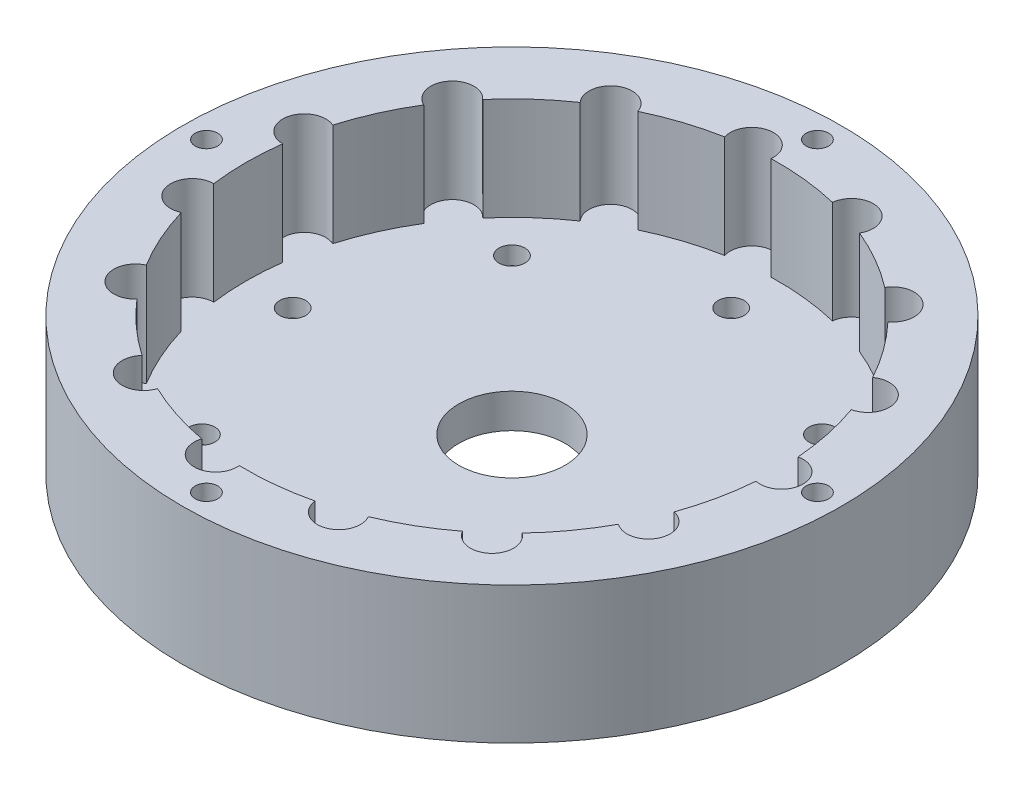
from build123d import *

# Parameters (mm, degrees)
SKETCH1_R           = 45.85
SKETCH1_R_2         = 1.5635
SKETCH1_R_3         = 7.4
BOSS_EXTRUDE1_DEPTH = 4.7625
SKETCH1_6_R         = 1.8125
CUT_EXTRUDE1_DEPTH  = 2.5
BOSS_EXTRUDE2_START = 14.2875
SKETCH1_7_R         = 45.85
SKETCH1_7_R_2       = 1.5635
BOSS_EXTRUDE2_DEPTH = 14.2875


with BuildPart() as part:
    # Sketch1 → Boss-Extrude1 (new body)
    with BuildSketch(Plane(origin=(0, 0, 0), x_dir=(1, 0, 0), z_dir=(0, 1, 0))):
        Circle(SKETCH1_R)
        with Locations((0, -42.5)):
            Circle(SKETCH1_R_2, mode=Mode.SUBTRACT)
        with Locations((-42.5, 0)):
            Circle(SKETCH1_R_2, mode=Mode.SUBTRACT)
        with Locations((42.5, 0)):
            Circle(SKETCH1_R_2, mode=Mode.SUBTRACT)
        with Locations((0, 42.5)):
            Circle(SKETCH1_R_2, mode=Mode.SUBTRACT)
        Circle(SKETCH1_R_3, mode=Mode.SUBTRACT)
    extrude(amount=-BOSS_EXTRUDE1_DEPTH)

    # Sketch1<6> → Cut-Extrude1 (cut)
    with BuildSketch(Plane(origin=(0, 0, 0), x_dir=(1, 0, 0), z_dir=(0, 1, 0))):
        with Locations((30.5, 0)):
            Circle(SKETCH1_6_R)
        with Locations((21.566756826, -21.566756826)):
            Circle(SKETCH1_6_R)
        with Locations((0, -30.5)):
            Circle(SKETCH1_6_R)
        with Locations((-21.566756826, -21.566756826)):
            Circle(SKETCH1_6_R)
        with Locations((-30.5, 0)):
            Circle(SKETCH1_6_R)
        with Locations((-21.566756826, 21.566756826)):
            Circle(SKETCH1_6_R)
        with Locations((0, 30.5)):
            Circle(SKETCH1_6_R)
        with Locations((21.566756826, 21.566756826)):
            Circle(SKETCH1_6_R)
    extrude(amount=-CUT_EXTRUDE1_DEPTH, mode=Mode.SUBTRACT)

    # Sketch1<7> → Boss-Extrude2 (add)
    with BuildSketch(Plane(origin=(0, 0, 0), x_dir=(1, 0, 0), z_dir=(0, 1, 0)).offset(BOSS_EXTRUDE2_START)):
        Circle(SKETCH1_7_R)
        with Locations((0, -42.5)):
            Circle(SKETCH1_7_R_2, mode=Mode.SUBTRACT)
        with Locations((-42.5, 0)):
            Circle(SKETCH1_7_R_2, mode=Mode.SUBTRACT)
        with Locations((42.5, 0)):
            Circle(SKETCH1_7_R_2, mode=Mode.SUBTRACT)
        with BuildLine():
            ThreePointArc((36.883333333, 2.935936345), (39.39076704, 2.32916294), (40.5, 0))
            ThreePointArc((40.5, 0), (39.39076704, -2.32916294), (36.883333333, -2.935936345))
            ThreePointArc((36.883333333, -2.935936345), (36.191461227, -7.69273256), (34.888754523, -12.319691873))
            ThreePointArc((34.888754523, -12.319691873), (36.59166411, -13.367471546), (37.257954662, -15.252624115))
            ThreePointArc((37.257954662, -15.252624115), (35.6231437, -17.924001829), (32.500448736, -17.683914497))
            ThreePointArc((32.500448736, -17.683914497), (29.933628792, -21.748054335), (26.861593101, -25.445133446))
            ThreePointArc((26.861593101, -25.445133446), (27.767055295, -26.50917897), (28.092397738, -27.867930955))
            ThreePointArc((28.092397738, -27.867930955), (25.872343464, -30.764771418), (22.497941295, -29.37418318))
            ThreePointArc((22.497941295, -29.37418318), (18.5, -32.04293994), (14.189818202, -34.170880284))
            ThreePointArc((14.189818202, -34.170880284), (14.486847583, -34.891651942), (14.588137289, -35.664619361))
            ThreePointArc((14.588137289, -35.664619361), (11.748752331, -38.660316744), (8.605335417, -35.985388734))
            ThreePointArc((8.605335417, -35.985388734), (3.867553141, -36.797310129), (-0.935505175, -36.988171489))
            ThreePointArc((-0.935505175, -36.988171489), (-0.92374189, -37.141170608), (-0.919817373, -37.294571076))
            ThreePointArc((-0.919817373, -37.294571076), (-4.385552663, -40.258199029), (-6.775211132, -36.37439366))
            ThreePointArc((-6.775211132, -36.37439366), (-11.433628792, -35.189091103), (-15.899071208, -33.409871815))
            ThreePointArc((-15.899071208, -33.409871815), (-20.25, -35.074028853), (-20.984262125, -30.47393547))
            ThreePointArc((-20.984262125, -30.47393547), (-24.757832435, -27.496358543), (-28.113543391, -24.054701786))
            ThreePointArc((-28.113543391, -24.054701786), (-32.765188272, -23.805302718), (-31.564943561, -19.304256991))
            ThreePointArc((-31.564943561, -19.304256991), (-33.801181933, -15.049255794), (-35.466928517, -10.540255288))
            ThreePointArc((-35.466928517, -10.540255288), (-39.61497783, -8.420423478), (-36.687759497, -4.796697105))
            ThreePointArc((-36.687759497, -4.796697105), (-37, 0), (-36.687759497, 4.796697105))
            ThreePointArc((-36.687759497, 4.796697105), (-39.61497783, 8.420423478), (-35.466928517, 10.540255288))
            ThreePointArc((-35.466928517, 10.540255288), (-33.801181933, 15.049255794), (-31.564943561, 19.304256991))
            ThreePointArc((-31.564943561, 19.304256991), (-32.765188272, 23.805302718), (-28.113543391, 24.054701786))
            ThreePointArc((-28.113543391, 24.054701786), (-24.757832435, 27.496358543), (-20.984262125, 30.47393547))
            ThreePointArc((-20.984262125, 30.47393547), (-20.25, 35.074028853), (-15.899071208, 33.409871815))
            ThreePointArc((-15.899071208, 33.409871815), (-11.433628792, 35.189091103), (-6.775211132, 36.37439366))
            ThreePointArc((-6.775211132, 36.37439366), (-4.385552663, 40.258199029), (-0.919817373, 37.294571076))
            ThreePointArc((-0.919817373, 37.294571076), (-0.92374189, 37.141170608), (-0.935505175, 36.988171489))
            ThreePointArc((-0.935505175, 36.988171489), (3.867553141, 36.797310129), (8.605335417, 35.985388734))
            ThreePointArc((8.605335417, 35.985388734), (11.748752331, 38.660316744), (14.588137289, 35.664619361))
            ThreePointArc((14.588137289, 35.664619361), (14.486847583, 34.891651942), (14.189818202, 34.170880284))
            ThreePointArc((14.189818202, 34.170880284), (18.5, 32.04293994), (22.497941295, 29.37418318))
            ThreePointArc((22.497941295, 29.37418318), (25.872343464, 30.764771418), (28.092397738, 27.867930955))
            ThreePointArc((28.092397738, 27.867930955), (27.767055295, 26.50917897), (26.861593101, 25.445133446))
            ThreePointArc((26.861593101, 25.445133446), (29.933628792, 21.748054335), (32.500448736, 17.683914497))
            ThreePointArc((32.500448736, 17.683914497), (35.6231437, 17.924001829), (37.257954662, 15.252624115))
            ThreePointArc((37.257954662, 15.252624115), (36.59166411, 13.367471546), (34.888754523, 12.319691873))
            ThreePointArc((34.888754523, 12.319691873), (36.191461227, 7.69273256), (36.883333333, 2.935936345))
        make_face(mode=Mode.SUBTRACT)
        with Locations((0, 42.5)):
            Circle(SKETCH1_7_R_2, mode=Mode.SUBTRACT)
    extrude(amount=-BOSS_EXTRUDE2_DEPTH)


solid = part.part
